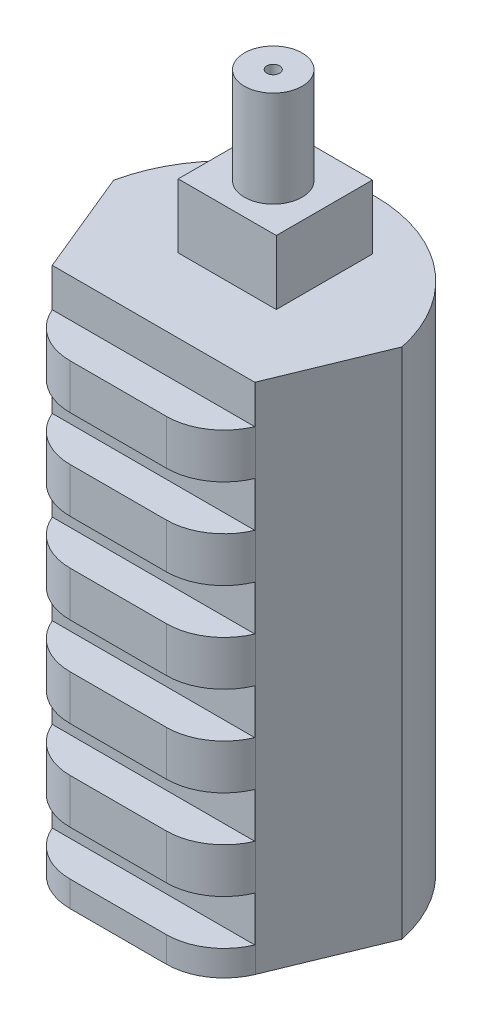
from build123d import *

# Parameters (mm, degrees)
BOSS_EXTRUDE1_DEPTH     = 80
BOSS_EXTRUDE2_DEPTH     = 5
BOSS_EXTRUDE3_START     = 75
BOSS_EXTRUDE3_DEPTH     = 5
CUT_EXTRUDE1_START      = 20
SKETCH2_W               = 31.64103086
SKETCH2_H               = 7
SKETCH2_H_2             = 6
CUT_EXTRUDE1_DEPTH      = 5.5
CROQUIS1_W              = 15.3
CROQUIS1_H              = 15
SALIENTE_EXTRUIR1_DEPTH = 10
CROQUIS2_R              = 4.5
CROQUIS2_R_2            = 1
SALIENTE_EXTRUIR2_DEPTH = 15
CORTAR_EXTRUIR1_START   = -24
CROQUIS2_2_R            = 1
CORTAR_EXTRUIR1_DEPTH   = 24


# Read off the part's stored shape, not the designer's step: Boss-Extrude3
with BuildPart() as part:
    # Sketch1 → Boss-Extrude1 (new body)
    with BuildSketch(Plane(origin=(0, 0, 0), x_dir=(1, 0, 0), z_dir=(0, 1, 0))):
        with BuildLine():
            Line((7.5, -20), (-7.5, -20))
            ThreePointArc((-7.5, -20), (-12.50622569, -18.479151312), (-15.82051543, -14.430600965))
            Line((-15.82051543, -14.430600965), (-22.5, 1.769696007))
            ThreePointArc((-22.5, 1.769696007), (-14.479243624, 14.870408615), (0, 20))
            ThreePointArc((0, 20), (14.479243624, 14.870408615), (22.5, 1.769696007))
            Line((22.5, 1.769696007), (15.82051543, -14.430600965))
            ThreePointArc((15.82051543, -14.430600965), (12.50622569, -18.479151312), (7.5, -20))
        make_face()
        with BuildLine():
            Line((-7.5, -13), (7.5, -13))
            ThreePointArc((7.5, -13), (11.393731092, -11.817117687), (13.971512001, -8.668245195))
            Line((13.971512001, -8.668245195), (15.06741388, -6.010265271))
            ThreePointArc((15.06741388, -6.010265271), (0, 16.5), (-15.06741388, -6.010265271))
            Line((-15.06741388, -6.010265271), (-13.971512001, -8.668245195))
            ThreePointArc((-13.971512001, -8.668245195), (-11.393731092, -11.817117687), (-7.5, -13))
        make_face(mode=Mode.SUBTRACT)
    extrude(amount=BOSS_EXTRUDE1_DEPTH)

    # Sketch1<2> → Boss-Extrude2 (add)
    with BuildSketch(Plane(origin=(0, 0, 0), x_dir=(1, 0, 0), z_dir=(0, 1, 0))):
        with BuildLine():
            ThreePointArc((-13.971512001, -8.668245195), (-11.393731092, -11.817117687), (-7.5, -13))
            Line((-7.5, -13), (7.5, -13))
            ThreePointArc((7.5, -13), (11.393731092, -11.817117687), (13.971512001, -8.668245195))
            Line((13.971512001, -8.668245195), (15.06741388, -6.010265271))
            ThreePointArc((15.06741388, -6.010265271), (0, 16.5), (-15.06741388, -6.010265271))
            Line((-15.06741388, -6.010265271), (-13.971512001, -8.668245195))
        make_face()
    extrude(amount=BOSS_EXTRUDE2_DEPTH)

    # Boss-Extrude3 outline → Boss-Extrude3 (add)
    with BuildSketch(Plane(origin=(0, 0, 0), x_dir=(1, 0, 0), z_dir=(0, 1, 0)).offset(BOSS_EXTRUDE3_START)):
        with BuildLine():
            Line((-15.06741388, -6.010265271), (-13.971512001, -8.668245195))
            ThreePointArc((-13.971512001, -8.668245195), (-11.393731092, -11.817117687), (-7.5, -13))
            Line((-7.5, -13), (7.5, -13))
            ThreePointArc((7.5, -13), (11.393731092, -11.817117687), (13.971512001, -8.668245195))
            Line((13.971512001, -8.668245195), (15.06741388, -6.010265271))
            ThreePointArc((15.06741388, -6.010265271), (0, 16.5), (-15.06741388, -6.010265271))
        make_face()
    extrude(amount=BOSS_EXTRUDE3_DEPTH)

    # Sketch2 → Cut-Extrude1 (cut)
    with BuildSketch(Plane.XY.offset(CUT_EXTRUDE1_START)):
        with Locations((0, 7.5)):
            Rectangle(SKETCH2_W, SKETCH2_H)
        with Locations((0, 21.5)):
            Rectangle(SKETCH2_W, SKETCH2_H)
        with Locations((0, 35.5)):
            Rectangle(SKETCH2_W, SKETCH2_H)
        with Locations((0, 49.5)):
            Rectangle(SKETCH2_W, SKETCH2_H)
        with Locations((0, 63.5)):
            Rectangle(SKETCH2_W, SKETCH2_H)
        with Locations((0, 77)):
            Rectangle(SKETCH2_W, SKETCH2_H_2)
    extrude(amount=-CUT_EXTRUDE1_DEPTH, mode=Mode.SUBTRACT)

    # Croquis1 → Saliente-Extruir1 (add)
    with BuildSketch(Plane(origin=(0, 80, 0), x_dir=(1, 0, 0), z_dir=(0, 1, 0))):
        with Locations((0, 4.5)):
            Rectangle(CROQUIS1_W, CROQUIS1_H)
    extrude(amount=SALIENTE_EXTRUIR1_DEPTH)

    # Croquis2 → Saliente-Extruir2 (add)
    with BuildSketch(Plane(origin=(0, 90, 0), x_dir=(1, 0, 0), z_dir=(0, 1, 0))):
        with Locations(Location((0, 4.172752701, 0), (0, 0, 270))):
            Circle(CROQUIS2_R)
        with Locations(Location((0, 4.172752701, 0), (0, 0, 270))):
            Circle(CROQUIS2_R_2, mode=Mode.SUBTRACT)
    extrude(amount=SALIENTE_EXTRUIR2_DEPTH)

    # Croquis2<2> → Cortar-Extruir1 (cut)
    with BuildSketch(Plane(origin=(0, 90, 0), x_dir=(1, 0, 0), z_dir=(0, 1, 0)).offset(CORTAR_EXTRUIR1_START)):
        with Locations(Location((0, 4.172752701, 0), (0, 0, 90))):
            Circle(CROQUIS2_2_R)
    extrude(amount=CORTAR_EXTRUIR1_DEPTH, mode=Mode.SUBTRACT)


solid = part.part
